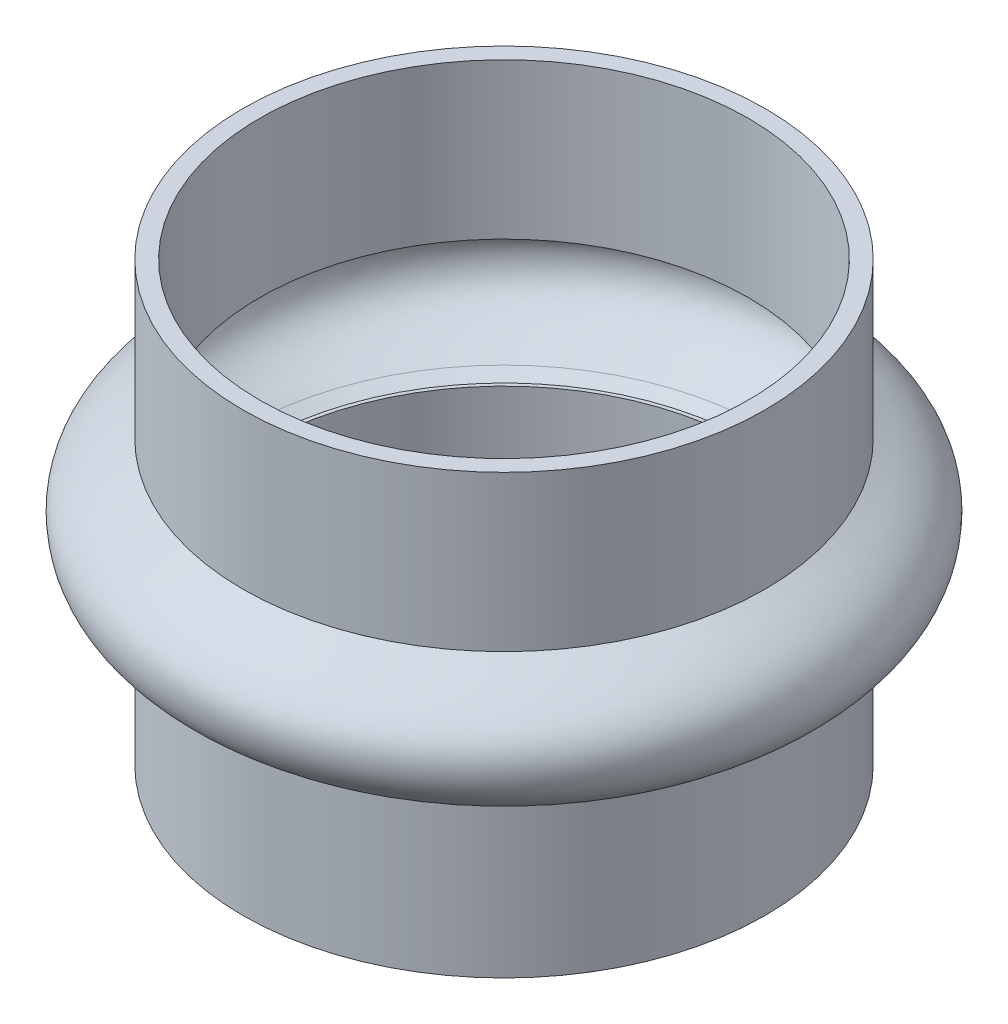
from build123d import *

# Parameters (mm, degrees)
SKETCH2_R           = 16.815
SKETCH2_R_2         = 15.729321286
BOSS_EXTRUDE1_DEPTH = 10


with BuildPart() as part:
    # Sketch1 → Revolve1 (revolve)
    with BuildSketch(Plane.XY):
        with BuildLine():
            Line((7.325278854, 63.411883954), (8.410957568, 63.411883954))
            Line((8.410957568, 63.411883954), (7.555549556, 62.968064842))
            add(Edge.make_bspline(
                [(7.555549556, 62.968064842), (7.34999991, 62.861417651), (6.947144673, 62.660387479), (6.05410487, 62.201842629), (4.95450234, 61.540590874), (4.15954484, 60.725704583), (3.843595581, 60.013758398), (3.734630504, 59.178179351), (3.989989442, 58.064696871), (4.831837818, 57.106551686), (6.08596344, 56.311379341), (6.949277865, 55.883126275), (7.373486281, 55.648841265)],
                knots=[0, 0, 0, 0, 0.0625, 0.125, 0.25, 0.375, 0.4375, 0.5, 0.625, 0.75, 0.875, 1, 1, 1, 1], degree=3))
            Line((7.373486281, 55.648841265), (8.165980219, 55.21115676))
            Line((8.165980219, 55.21115676), (7.131758595, 55.21115676))
            add(Edge.make_bspline(
                [(7.325278854, 63.411883954), (6.011135244, 62.730054884), (2.971783405, 61.4251647), (3.46335157, 56.912604996), (5.942640085, 55.867892063), (7.131758595, 55.21115676)],
                knots=[0, 0, 0, 0, 0.430000258, 0.624673055, 1, 1, 1, 1], degree=3))
        make_face()
    revolve(axis=Axis((24.140278854, 76.539342874, 0), (0, -1, 0)))

    # Sketch2 → Boss-Extrude1 (add)
    with BuildSketch(Plane(origin=(0, 63.411883954, 0), x_dir=(1, 0, 0), z_dir=(0, 1, 0))):
        with Locations((24.140278854, 0)):
            Circle(SKETCH2_R)
        with Locations((24.140278854, 0)):
            Circle(SKETCH2_R_2, mode=Mode.SUBTRACT)
    boss_extrude1 = extrude(amount=BOSS_EXTRUDE1_DEPTH)

    # Mirror1: Boss-Extrude1 across plane
    add(boss_extrude1.mirror(Plane.ZX.offset(59.311520357)))


solid = part.part
